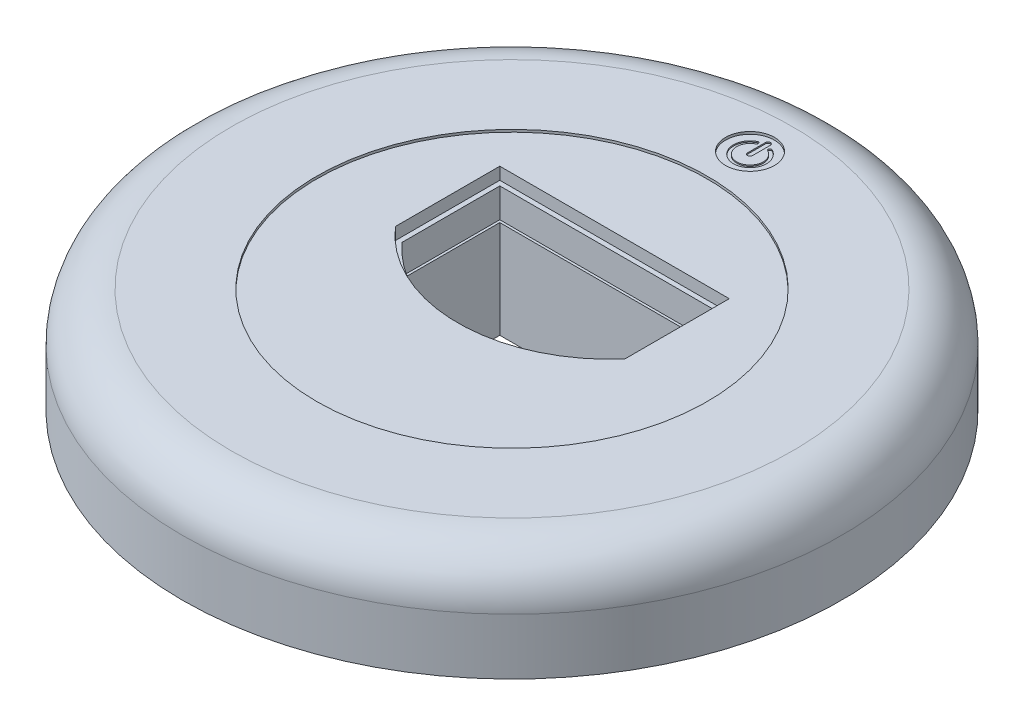
from build123d import *

# Parameters (mm, degrees)
CROQUIS1_R              = 135
SALIENTE_EXTRUIR1_DEPTH = 43
REDONDEO5_R             = 20
CROQUIS2_R              = 133
CORTAR_EXTRUIR6_DEPTH   = 25
REDONDEO6_R             = 25
CROQUIS4_R              = 80
CORTAR_EXTRUIR7_DEPTH   = 1
CORTAR_EXTRUIR8_DEPTH   = 67
CROQUIS6_R              = 10
CORTAR_EXTRUIR9_DEPTH   = 1
CORTAR_EXTRUIR10_DEPTH  = 0.5
SALIENTE_EXTRUIR3_DEPTH = 40
SALIENTE_EXTRUIR4_DEPTH = 5
CORTAR_EXTRUIR11_DEPTH  = 5


with BuildPart() as part:
    # Croquis1 → Saliente-Extruir1 (new body)
    with BuildSketch(Plane(origin=(0, 0, 0), x_dir=(1, 0, 0), z_dir=(0, 1, 0))):
        with Locations(Location((0, 0, 0), (0, 0, 270))):
            Circle(CROQUIS1_R)
    extrude(amount=SALIENTE_EXTRUIR1_DEPTH)

    # Redondeo5
    redondeo5_edges = [part.edges().sort_by_distance(p)[0] for p in [
        (0, 43, -135),
    ]]
    fillet(redondeo5_edges, radius=REDONDEO5_R)

    # Croquis2 → Cortar-Extruir6 (cut)
    with BuildSketch(Plane(origin=(0, 0, 0), x_dir=(-1, 0, 0), z_dir=(0, -1, 0))):
        with Locations(Location((0, 0, 0), (0, 0, 90))):
            Circle(CROQUIS2_R)
    extrude(amount=-CORTAR_EXTRUIR6_DEPTH, mode=Mode.SUBTRACT)

    # Redondeo6
    redondeo6_edges = [part.edges().sort_by_distance(p)[0] for p in [
        (0, 25, 133),
    ]]
    fillet(redondeo6_edges, radius=REDONDEO6_R - 0.0001)  # a hair under: the kernel refuses the full size

    # Croquis4 → Cortar-Extruir7 (cut)
    with BuildSketch(Plane(origin=(0, 43, 0), x_dir=(1, 0, 0), z_dir=(0, 1, 0))):
        with Locations(Location((0, 0, 0), (0, 0, 270))):
            Circle(CROQUIS4_R)
    extrude(amount=-CORTAR_EXTRUIR7_DEPTH, mode=Mode.SUBTRACT)

    # Croquis5 → Cortar-Extruir8 (cut)
    with BuildSketch(Plane(origin=(0, 42, 0), x_dir=(1, 0, 0), z_dir=(0, 1, 0))):
        with BuildLine():
            Line((-45, 0), (-45, 40))
            Line((-45, 40), (45, 40))
            Line((45, 40), (45, 0))
            ThreePointArc((45, 0), (0, -20.207972894), (-45, 0))
        make_face()
    extrude(amount=-CORTAR_EXTRUIR8_DEPTH, mode=Mode.SUBTRACT)

    # Croquis6 → Cortar-Extruir9 (cut)
    with BuildSketch(Plane(origin=(0, 43, 0), x_dir=(1, 0, 0), z_dir=(0, 1, 0))):
        with Locations(Location((0, 97.5, 0), (0, 0, 270))):
            Circle(CROQUIS6_R)
    extrude(amount=-CORTAR_EXTRUIR9_DEPTH, mode=Mode.SUBTRACT)

    # Croquis7 → Cortar-Extruir10 (cut)
    with BuildSketch(Plane(origin=(0, 42, 0), x_dir=(1, 0, 0), z_dir=(0, 1, 0))):
        with BuildLine():
            Line((-1, 97.5), (-1, 104.846686009))
            ThreePointArc((-1, 104.846686009), (0, 105.846686009), (1, 104.846686009))
            Line((1, 104.846686009), (1, 97.5))
            ThreePointArc((1, 97.5), (0, 96.5), (-1, 97.5))
        make_face()
        with BuildLine():
            ThreePointArc((-3.025522609, 103.54170716), (0.056423139, 90.743312284), (2.924202621, 103.591391589))
            ThreePointArc((2.924202621, 103.591391589), (2.037712876, 103.279966687), (2.349137778, 102.393476942))
            ThreePointArc((2.349137778, 102.393476942), (0.045327135, 92.072062056), (-2.430532483, 102.353563302))
            ThreePointArc((-2.430532483, 102.353563302), (-2.133955617, 103.245130294), (-3.025522609, 103.54170716))
        make_face()
    extrude(amount=-CORTAR_EXTRUIR10_DEPTH, mode=Mode.SUBTRACT)



with BuildPart() as body_2:
    # Croquis9 → Saliente-Extruir3 (new body)
    with BuildSketch(Plane.XZ.offset(-25)):
        with BuildLine():
            Line((45, -40), (-45, -40))
            Line((-45, -40), (-45, 0))
            ThreePointArc((-45, 0), (0, 20.207972894), (45, 0))
            Line((45, 0), (45, -40))
        make_face()
        with BuildLine():
            Line((44, -39), (-44, -39))
            Line((-44, -39), (-44, -0.382023598))
            ThreePointArc((-44, -0.382023598), (0, 19.207972894), (44, -0.382023598))
            Line((44, -0.382023598), (44, -39))
        make_face(mode=Mode.SUBTRACT)
    extrude(amount=SALIENTE_EXTRUIR3_DEPTH)


with BuildPart() as part_1:
    add(part.part)

    add(body_2.part)  # Saliente-Extruir4 merges body 2
    # Croquis11 → Saliente-Extruir4 (add)
    with BuildSketch(Plane.XZ.offset(-25)):
        with BuildLine():
            Line((47, -42), (47, 0.753305284))
            ThreePointArc((47, 0.753305284), (0, 22.207972894), (-47, 0.753305284))
            Line((-47, 0.753305284), (-47, -42))
            Line((-47, -42), (47, -42))
        make_face()
        with BuildLine():
            Line((45, 0), (45, -40))
            Line((45, -40), (-45, -40))
            Line((-45, -40), (-45, 0))
            ThreePointArc((-45, 0), (0, 20.207972894), (45, 0))
        make_face(mode=Mode.SUBTRACT)
    extrude(amount=SALIENTE_EXTRUIR4_DEPTH)

    # Croquis12 → Cortar-Extruir11 (cut)
    with BuildSketch(Plane(origin=(0, 42, 0), x_dir=(1, 0, 0), z_dir=(0, 1, 0))):
        with BuildLine():
            Line((47, -0.753305284), (47, 42))
            Line((47, 42), (-47, 42))
            Line((-47, 42), (-47, -0.753305284))
            ThreePointArc((-47, -0.753305284), (0, -22.207972894), (47, -0.753305284))
        make_face()
        with BuildLine():
            Line((45, 40), (-45, 40))
            Line((-45, 40), (-45, 0))
            ThreePointArc((-45, 0), (0, -20.207972894), (45, 0))
            Line((45, 0), (45, 40))
        make_face(mode=Mode.SUBTRACT)
    extrude(amount=-CORTAR_EXTRUIR11_DEPTH, mode=Mode.SUBTRACT)


solid = part_1.part
